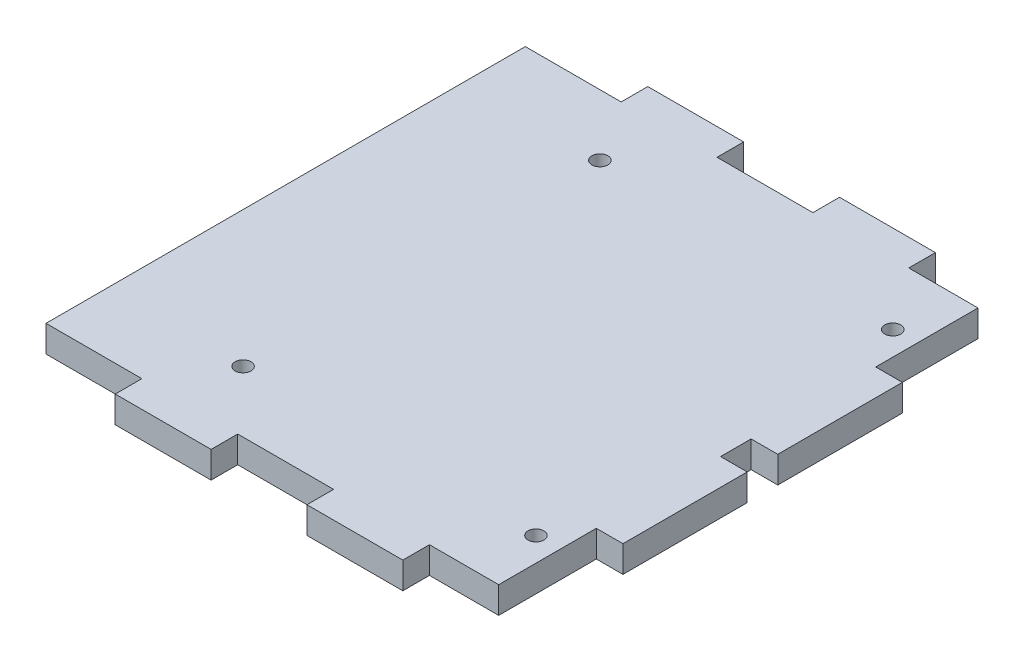
from build123d import *

# Parameters (mm, degrees)
SKETCH1_W           = 114.3
SKETCH1_H           = 127
BOSS_EXTRUDE1_DEPTH = 6.35
CAVITY2_START       = 50.8
CAVITY2_OUTLINE_W   = 6.35
CAVITY2_OUTLINE_H   = 29.633333333
CAVITY2_OUTLINE_H_2 = 7.281333333
CAVITY2_OUTLINE_H_3 = 30.734
CAVITY2_DEPTH       = 6.35
CAVITY2_START_2     = -57.15
CAVITY2_2_OUTLINE_W = 6.35
CAVITY2_2_OUTLINE_H = 6.35
CAVITY2_2_DEPTH     = 22.86
CAVITY2_START_3     = -11.43
CAVITY2_3_OUTLINE_W = 6.35
CAVITY2_3_OUTLINE_H = 6.35
CAVITY2_3_DEPTH     = 22.86
CAVITY2_START_4     = 34.29
CAVITY2_4_OUTLINE_W = 6.35
CAVITY2_4_OUTLINE_H = 6.35
CAVITY2_4_DEPTH     = 16.51
SKETCH2_R           = 1.905
CUT_EXTRUDE1_DEPTH  = 86.666183527


# Read off the part's stored shape, not the designer's step: Cavity2
with BuildPart() as part:
    # Sketch1 → Boss-Extrude1 (new body)
    with BuildSketch(Plane(origin=(0, 0, 0), x_dir=(1, 0, 0), z_dir=(0, 1, 0))):
        Rectangle(SKETCH1_W, SKETCH1_H)
    extrude(amount=BOSS_EXTRUDE1_DEPTH)

    # Cavity2 outline → Cavity2 (cut)
    with BuildSketch(Plane.YZ.offset(CAVITY2_START)):
        with Locations((3.175, 48.683333334)):
            Rectangle(CAVITY2_OUTLINE_W, CAVITY2_OUTLINE_H)
        with Locations((3.175, 0.592666666)):
            Rectangle(CAVITY2_OUTLINE_W, CAVITY2_OUTLINE_H_2)
        with Locations((3.175, -48.133)):
            Rectangle(CAVITY2_OUTLINE_W, CAVITY2_OUTLINE_H_3)
    extrude(amount=CAVITY2_DEPTH, mode=Mode.SUBTRACT)

    # Cavity2 2 outline → Cavity2 2 (cut)
    with BuildSketch(Plane.YZ.offset(CAVITY2_START_2)):
        with Locations((3.175, 60.325)):
            Rectangle(CAVITY2_2_OUTLINE_W, CAVITY2_2_OUTLINE_H)
        with Locations((3.175, -60.325)):
            Rectangle(CAVITY2_2_OUTLINE_W, CAVITY2_2_OUTLINE_H)
    extrude(amount=CAVITY2_2_DEPTH, mode=Mode.SUBTRACT)

    # Cavity2 3 outline → Cavity2 3 (cut)
    with BuildSketch(Plane.YZ.offset(CAVITY2_START_3)):
        with Locations((3.175, 60.325)):
            Rectangle(CAVITY2_3_OUTLINE_W, CAVITY2_3_OUTLINE_H)
        with Locations((3.175, -60.325)):
            Rectangle(CAVITY2_3_OUTLINE_W, CAVITY2_3_OUTLINE_H)
    extrude(amount=CAVITY2_3_DEPTH, mode=Mode.SUBTRACT)

    # Cavity2 4 outline → Cavity2 4 (cut)
    with BuildSketch(Plane.YZ.offset(CAVITY2_START_4)):
        with Locations((3.175, 60.325)):
            Rectangle(CAVITY2_4_OUTLINE_W, CAVITY2_4_OUTLINE_H)
        with Locations((3.175, -60.325)):
            Rectangle(CAVITY2_4_OUTLINE_W, CAVITY2_4_OUTLINE_H)
    extrude(amount=CAVITY2_4_DEPTH, mode=Mode.SUBTRACT)

    # Sketch2 → Cut-Extrude1 (cut, through all)
    with BuildSketch(Plane.XZ):
        with Locations(Location((45.085, -42.545, 0), (0, 0, 270))):
            Circle(SKETCH2_R)
        with Locations(Location((-24.765, -42.545, 0), (0, 0, 270))):
            Circle(SKETCH2_R)
        with Locations(Location((45.085, 42.545, 0), (0, 0, 270))):
            Circle(SKETCH2_R)
        with Locations(Location((-24.765, 42.545, 0), (0, 0, 270))):
            Circle(SKETCH2_R)
    extrude(amount=-CUT_EXTRUDE1_DEPTH, mode=Mode.SUBTRACT)


solid = part.part
